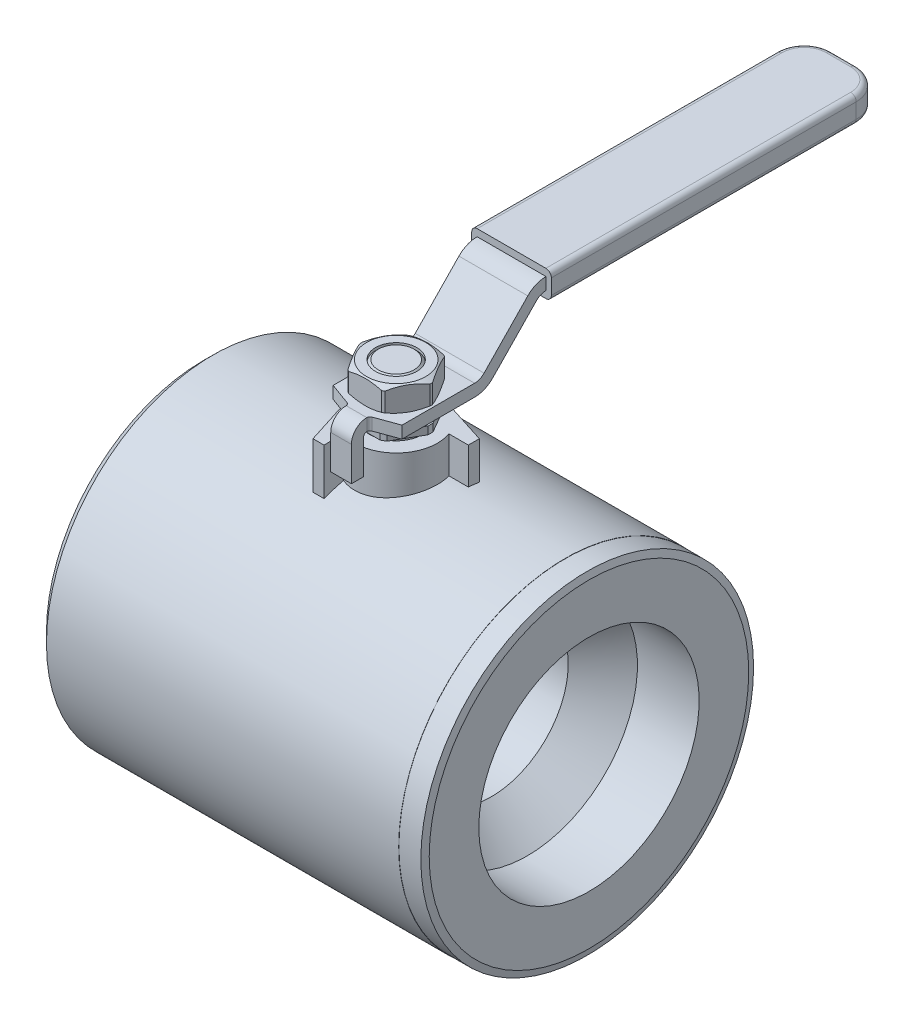
from build123d import *

# Parameters (mm, degrees)
SKETCH7_R          = 18.455087153
CUT_EXTRUDE4_DEPTH = 15.24
EXTRUDE2_DEPTH     = 7.9375
FILLET4_R          = 4.7625
SKETCH9_W          = 76.625038023
SKETCH9_H          = 6.0452
EXTRUDE3_DEPTH     = 9.1821
FILLET5_R          = 6.35
FILLET6_R          = 1.27
CUT_EXTRUDE5_DEPTH = 12.7
EXTRUDE1_START     = 2.54
EXTRUDE1_DEPTH     = 20.574


with BuildPart() as part:
    # Sketch1 → Revolve1 (revolve)
    with BuildSketch(Plane.XY):
        Polygon((-30.226, 1.852523446), (-21.937881055, -5.806854399), (21.937881055, -5.806854399), (30.226, 1.852523446), (31.496, 1.852523446), (44.45, 1.852523446), (44.45, 13.282523446), (44.041645431, 14.806523446), (38.989, 14.806523446), (38.989, 14.859), (-42.2148, 14.859), (-44.45, 12.6238), (-44.45, 1.852523446), (-31.496, 1.852523446), align=None)
    revolve(axis=Axis((-26.37659844, -23.547476554, 0), (1, 0, 0)))

    # Sketch6 → Revolve2 (revolve)
    with BuildSketch(Plane.XY):
        Polygon((0, 12.7), (6.096, 12.7), (6.096, 24.257), (7.9375, 24.257), (7.9375, 26.035), (4.7625, 26.035), (4.7625, 29.21), (6.8199, 29.21), (8.0899, 29.943234842), (8.0899, 34.318765158), (6.8199, 35.052), (4.7625, 35.052), (4.7625, 34.417), (4.1275, 35.052), (0, 35.052), align=None)
    revolve(axis=Axis((0, 12.7, 0), (0, -1, 0)))

    # Sketch7 → Cut-Extrude4 (cut)
    with BuildSketch(Plane(origin=(0, 35.052, 0), x_dir=(-1, 0, 0), z_dir=(0, 1, 0))):
        Circle(SKETCH7_R)
        Polygon((4.124445986, 7.14375), (-4.124445986, 7.14375), (-8.248891971, 0), (-4.124445986, -7.14375), (4.124445986, -7.14375), (8.248891971, 0), align=None, mode=Mode.SUBTRACT)
    extrude(amount=-CUT_EXTRUDE4_DEPTH, mode=Mode.SUBTRACT)

    # Sketch8 → Extrude2 (add, symmetric)
    with BuildSketch(Plane(origin=(0, 0, 0), x_dir=(0, 0, -1), z_dir=(1, 0, 0))):
        with BuildLine():
            Line((-9.906, 17.78), (-9.906, 25.654))
            ThreePointArc((-9.906, 25.654), (-9.682815367, 26.192815367), (-9.144, 26.416))
            Line((-9.144, 26.416), (10.141011142, 26.416))
            ThreePointArc((10.141011142, 26.416), (12.416465023, 26.877361224), (14.332519319, 28.188574586))
            Line((14.332519319, 28.188574586), (24.413688146, 38.572178477))
            ThreePointArc((24.413688146, 38.572178477), (25.413368648, 39.256289796), (26.600561977, 39.497))
            Line((26.600561977, 39.497), (101.6, 39.497))
            Line((101.6, 39.497), (101.6, 42.291))
            Line((101.6, 42.291), (26.600561977, 42.291))
            ThreePointArc((26.600561977, 42.291), (24.325108096, 41.829638776), (22.4090538, 40.518425414))
            Line((22.4090538, 40.518425414), (12.327884974, 30.134821523))
            ThreePointArc((12.327884974, 30.134821523), (11.328204472, 29.450710204), (10.141011142, 29.21))
            Line((10.141011142, 29.21), (-9.144, 29.21))
            ThreePointArc((-9.144, 29.21), (-11.658471714, 28.168471714), (-12.7, 25.654))
            Line((-12.7, 25.654), (-12.7, 17.78))
            Line((-12.7, 17.78), (-9.906, 17.78))
        make_face()
    extrude(amount=EXTRUDE2_DEPTH, both=True)

    # Fillet4
    fillet4_edges = [part.edges().sort_by_distance(p)[0] for p in [
        (7.9375, 40.894, -101.6),
        (-7.9375, 40.894, -101.6),
    ]]
    fillet(fillet4_edges, radius=FILLET4_R)

    # Sketch9 → Extrude3 (add, symmetric)
    with BuildSketch(Plane(origin=(0, 0, 0), x_dir=(0, 0, -1), z_dir=(1, 0, 0))):
        with Locations((64.913080988, 40.894)):
            Rectangle(SKETCH9_W, SKETCH9_H)
    extrude(amount=EXTRUDE3_DEPTH, both=True)

    # Fillet5
    fillet5_edges = [part.edges().sort_by_distance(p)[0] for p in [
        (-9.1821, 40.894, -103.2256),
        (9.1821, 40.894, -103.2256),
    ]]
    fillet(fillet5_edges, radius=FILLET5_R)

    # Fillet6
    fillet6_edges = [part.edges().sort_by_distance(p)[0] for p in [
        (-9.1821, 37.8714, -61.738080989),
        (-7.322228061, 37.8714, -101.365728061),
        (0, 37.8714, -103.2256),
        (7.322228061, 37.8714, -101.365728061),
        (9.1821, 37.8714, -61.738080989),
        (-9.1821, 43.9166, -61.738080989),
        (-7.322228061, 43.9166, -101.365728061),
        (0, 43.9166, -103.2256),
        (7.322228061, 43.9166, -101.365728061),
        (9.1821, 43.9166, -61.738080989),
    ]]
    fillet(fillet6_edges, radius=FILLET6_R)

    # Sketch10 → Cut-Extrude5 (cut)
    with BuildSketch(Plane(origin=(0, 29.21, 0), x_dir=(-1, 0, 0), z_dir=(0, 1, 0))):
        with BuildLine():
            Line((-7.9375, 12.7), (-2.38125, 12.7))
            Line((-2.38125, 12.7), (-2.38125, 9.144))
            ThreePointArc((-2.38125, 9.144), (-2.519056142, 8.706934756), (-2.882630651, 8.427954223))
            Line((-2.882630651, 8.427954223), (-7.9375, 6.588132242))
            Line((-7.9375, 6.588132242), (-7.9375, 12.7))
        make_face()
        with BuildLine():
            Line((7.9375, 6.588132242), (7.9375, 12.7))
            Line((7.9375, 12.7), (2.38125, 12.7))
            Line((2.38125, 12.7), (2.38125, 9.144))
            ThreePointArc((2.38125, 9.144), (2.519056142, 8.706934756), (2.882630651, 8.427954223))
            Line((2.882630651, 8.427954223), (7.9375, 6.588132242))
        make_face()
    extrude(amount=-CUT_EXTRUDE5_DEPTH, mode=Mode.SUBTRACT)

    # Sketch4 → Extrude1 (add)
    with BuildSketch(Plane(origin=(0, 0, 0), x_dir=(1, 0, 0), z_dir=(0, 1, 0)).offset(EXTRUDE1_START)):
        with BuildLine():
            Line((-3.175, -8.980256121), (-3.175, -13.462))
            Line((-3.175, -13.462), (-5.715, -13.462))
            Line((-5.715, -13.462), (-9.07732009, -2.885807509))
            ThreePointArc((-9.07732009, -2.885807509), (-6.735192091, 6.735192091), (2.885807509, 9.07732009))
            Line((2.885807509, 9.07732009), (13.462, 5.715))
            Line((13.462, 5.715), (13.462, 3.175))
            Line((13.462, 3.175), (8.980256121, 3.175))
            ThreePointArc((8.980256121, 3.175), (6.735192091, -6.735192091), (-3.175, -8.980256121))
        make_face()
    extrude(amount=EXTRUDE1_DEPTH)


solid = part.part
